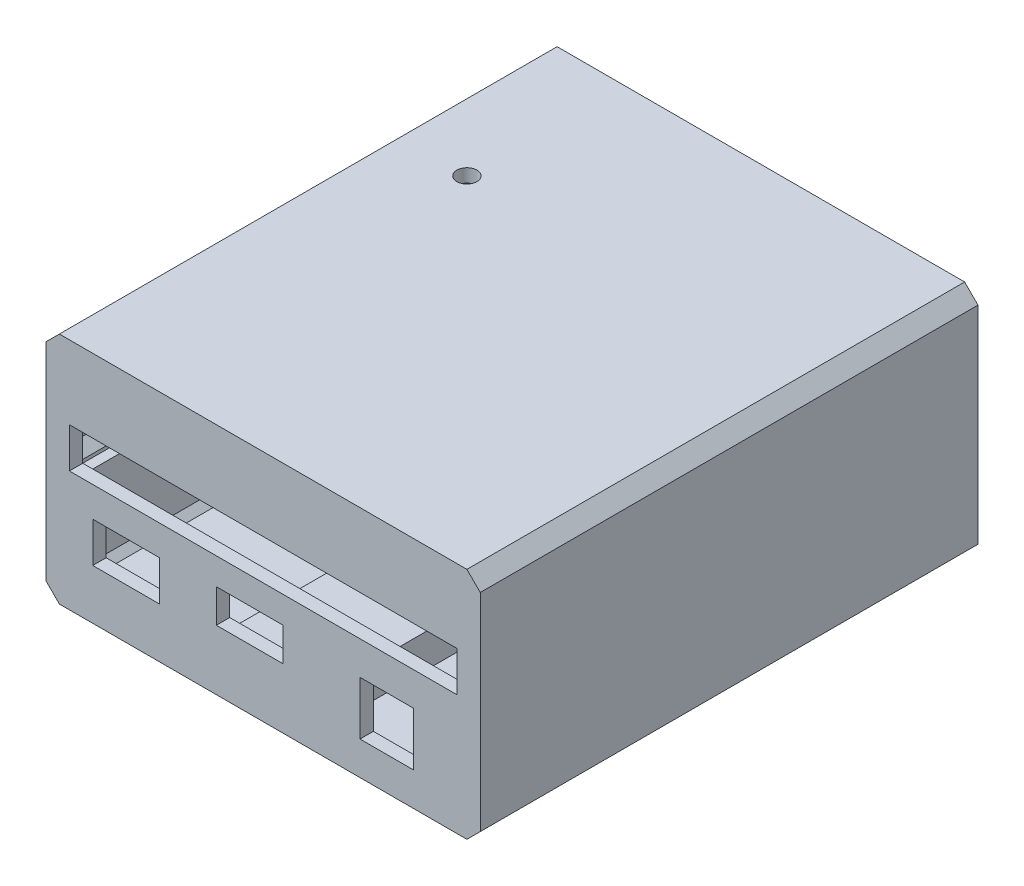
from build123d import *
from OCP.BRepFilletAPI import BRepFilletAPI_MakeChamfer

# Parameters (mm, degrees)
CROQUIS1_W              = 3.5
CROQUIS1_H              = 6
CROQUIS1_W_2            = 10
CROQUIS1_H_2            = 5
CROQUIS1_W_3            = 8
CROQUIS1_H_3            = 8
SALIENTE_EXTRUIR1_DEPTH = 2
CROQUIS2_W              = 65
CROQUIS2_H              = 35
CROQUIS2_W_2            = 61
CROQUIS2_H_2            = 31
SALIENTE_EXTRUIR2_DEPTH = 71
SALIENTE_EXTRUIR3_DEPTH = 70
CORTAR_EXTRUIR2_REACH   = 87.57
CROQUIS9_R              = 1.5
CHAFL_N3_SIZE           = 2
CHAFL_N2_SIZE           = 1
BOSS_EXTRUDE1_DEPTH     = 1.5
CHAMFER1_SIZE           = 0.1
CHAMFER1_SIZE_2         = 1.5
SKETCH2_W               = 1
SKETCH2_H               = 2
BOSS_EXTRUDE2_DEPTH     = 0.5
SKETCH3_W               = 15
SKETCH3_H               = 20
BOSS_EXTRUDE3_DEPTH     = 7
SKETCH4_W               = 13
SKETCH4_H               = 18
CUT_EXTRUDE1_DEPTH      = 5
SKETCH5_W               = 13
SKETCH5_H               = 2.5
BOSS_EXTRUDE4_DEPTH     = 12
CHAMFER2_SIZE2          = 5
CHAMFER2_SIZE           = 8.660254038
CHAMFER3_SIZE2          = 5
CHAMFER3_SIZE           = 8.660254038
CHAMFER4_SIZE           = 3
CHAMFER4_SIZE2          = 1.732050808
BOSS_EXTRUDE5_REACH     = 76.315
SKETCH6_W               = 15
SKETCH6_H               = 5
BOSS_EXTRUDE6_REACH     = 171.868
SKETCH7_W               = 9.865861754
SKETCH7_H               = 0.5


with BuildPart() as part:
    # Croquis1 → Saliente-Extruir1 (new body)
    # profile 1 of 4: a face of its own
    with BuildSketch(Plane.XY):
        Polygon((-32.5, 6.5), (-29, 6.5), (29, 6.5), (32.5, 6.5), (32.5, 17.5), (-32.5, 17.5), align=None)
    # profile 2 of 4: a face of its own
    with BuildSketch(Plane.XY):
        with Locations((-30.75, 3.5)):
            Rectangle(CROQUIS1_W, CROQUIS1_H)
    # profile 3 of 4: a face of its own
    with BuildSketch(Plane.XY):
        with Locations((30.75, 3.5)):
            Rectangle(CROQUIS1_W, CROQUIS1_H)
    # profile 4 of 4: a face of its own
    with BuildSketch(Plane.XY):
        Polygon((29, 0.5), (-29, 0.5), (-32.5, 0.5), (-32.5, -17.5), (32.5, -17.5), (32.5, 0.5), align=None)
        with Locations((-20.5, -7)):
            Rectangle(CROQUIS1_W_2, CROQUIS1_H, mode=Mode.SUBTRACT)
        with Locations((-2, -6)):
            Rectangle(CROQUIS1_W_2, CROQUIS1_H_2, mode=Mode.SUBTRACT)
        with Locations((18.5, -8.5)):
            Rectangle(CROQUIS1_W_3, CROQUIS1_H_3, mode=Mode.SUBTRACT)
    extrude(amount=SALIENTE_EXTRUIR1_DEPTH)

    # Croquis2 → Saliente-Extruir2 (add)
    with BuildSketch(Plane(origin=(0, 0, 0), x_dir=(-1, 0, 0), z_dir=(0, 0, -1))):
        Rectangle(CROQUIS2_W, CROQUIS2_H)
        Rectangle(CROQUIS2_W_2, CROQUIS2_H_2, mode=Mode.SUBTRACT)
    extrude(amount=SALIENTE_EXTRUIR2_DEPTH)

    # Croquis3 → Saliente-Extruir3 (add)
    with BuildSketch(Plane(origin=(0, 0, 0), x_dir=(-1, 0, 0), z_dir=(0, 0, -1))):
        Polygon((-30.5, 1), (-29, 1), (-30.5, 2.5), align=None)
        Polygon((-30.5, -1), (-30.5, -2.5), (-29, -1), align=None)
        Polygon((30.5, -1), (29, -1), (30.5, -2.5), align=None)
        Polygon((30.5, 1), (30.5, 2.5), (29, 1), align=None)
    extrude(amount=SALIENTE_EXTRUIR3_DEPTH)

    # Croquis9 → Cortar-Extruir2 (cut, up to next)
    with BuildSketch(Plane(origin=(0, 17.5, 0), x_dir=(1, 0, 0), z_dir=(0, 1, 0)), mode=Mode.PRIVATE) as cortar_extruir2_sk1:
        with Locations(Location((-20.5, 49, 0), (0, 0, 270))):
            Circle(CROQUIS9_R)
    cortar_extruir2_tool1 = extrude(cortar_extruir2_sk1.sketch, amount=-CORTAR_EXTRUIR2_REACH, mode=Mode.PRIVATE) & part.part
    add(cortar_extruir2_tool1.solids().sort_by_distance((-20.5, 17.5, -49))[0], mode=Mode.SUBTRACT)

    # Chaflán3
    chafl_n3_edges = [part.edges().sort_by_distance(p)[0] for p in [
        (-32.5, -17.5, -34.5),
        (-32.5, 17.5, -34.5),
        (32.5, 17.5, -34.5),
        (32.5, -17.5, -34.5),
    ]]
    chamfer(chafl_n3_edges, length=CHAFL_N3_SIZE)

    # Chaflán2
    chafl_n2_edges = [part.edges().sort_by_distance(p)[0] for p in [
        (-30.5, 15.5, -35.5),
        (30.5, 15.5, -35.5),
        (30.5, -15.5, -35.5),
        (-30.5, -15.5, -35.5),
    ]]
    chamfer(chafl_n2_edges, length=CHAFL_N2_SIZE)

    # Sketch1 → Boss-Extrude1 (add)
    with BuildSketch(Plane(origin=(0, 0, -71), x_dir=(-1, 0, 0), z_dir=(0, 0, -1))):
        Polygon((-32.5, 15.5), (-32.5, -15.5), (-30.5, -17.5), (30.5, -17.5), (32.5, -15.5), (32.5, 15.5), (30.5, 17.5), (-30.5, 17.5), align=None)
        Polygon((-31.55, 15.106497116), (-31.55, -15.106497116), (-30.106497116, -16.55), (30.106497116, -16.55), (31.55, -15.106497116), (31.55, 15.106497116), (30.106497116, 16.55), (-30.106497116, 16.55), align=None, mode=Mode.SUBTRACT)
    extrude(amount=BOSS_EXTRUDE1_DEPTH)

    # Chamfer1
    chamfer1_edges_1 = [part.edges().sort_by_distance(p)[0] for p in [
        (0, -16.55, -72.5),
    ]]
    chamfer1_side_1 = [part.faces().sort_by_distance(p)[0] for p in [
        (0, -16.552, -72.5),
    ]]
    chamfer1_edges_2 = [part.edges().sort_by_distance(p)[0] for p in [
        (-30.828248558, -15.828248558, -72.5),
    ]]
    chamfer1_side_2 = [part.faces().sort_by_distance(p)[0] for p in [
        (-30.829662771, -15.829662771, -72.5),
    ]]
    chamfer1_edges_3 = [part.edges().sort_by_distance(p)[0] for p in [
        (-31.55, 0, -72.5),
    ]]
    chamfer1_side_3 = [part.faces().sort_by_distance(p)[0] for p in [
        (-31.552, 0, -72.5),
    ]]
    chamfer1_edges_4 = [part.edges().sort_by_distance(p)[0] for p in [
        (-30.828248558, 15.828248558, -72.5),
    ]]
    chamfer1_side_4 = [part.faces().sort_by_distance(p)[0] for p in [
        (-30.829662771, 15.829662771, -72.5),
    ]]
    chamfer1_edges_5 = [part.edges().sort_by_distance(p)[0] for p in [
        (0, 16.55, -72.5),
    ]]
    chamfer1_side_5 = [part.faces().sort_by_distance(p)[0] for p in [
        (0, 16.552, -72.5),
    ]]
    chamfer1_edges_6 = [part.edges().sort_by_distance(p)[0] for p in [
        (30.828248558, 15.828248558, -72.5),
    ]]
    chamfer1_side_6 = [part.faces().sort_by_distance(p)[0] for p in [
        (30.829662771, 15.829662771, -72.5),
    ]]
    chamfer1_edges_7 = [part.edges().sort_by_distance(p)[0] for p in [
        (31.55, 0, -72.5),
    ]]
    chamfer1_side_7 = [part.faces().sort_by_distance(p)[0] for p in [
        (31.552, 0, -72.5),
    ]]
    chamfer1_edges_8 = [part.edges().sort_by_distance(p)[0] for p in [
        (30.828248558, -15.828248558, -72.5),
    ]]
    chamfer1_side_8 = [part.faces().sort_by_distance(p)[0] for p in [
        (30.829662771, -15.829662771, -72.5),
    ]]
    chamfer1 = BRepFilletAPI_MakeChamfer(part.part.solid().wrapped)
    for e in chamfer1_edges_1:
        chamfer1.Add(CHAMFER1_SIZE - 0.0001, CHAMFER1_SIZE_2 - 0.0001, e.wrapped, chamfer1_side_1[0].wrapped)
    for e in chamfer1_edges_2:
        chamfer1.Add(CHAMFER1_SIZE - 0.0001, CHAMFER1_SIZE_2 - 0.0001, e.wrapped, chamfer1_side_2[0].wrapped)
    for e in chamfer1_edges_3:
        chamfer1.Add(CHAMFER1_SIZE - 0.0001, CHAMFER1_SIZE_2 - 0.0001, e.wrapped, chamfer1_side_3[0].wrapped)
    for e in chamfer1_edges_4:
        chamfer1.Add(CHAMFER1_SIZE - 0.0001, CHAMFER1_SIZE_2 - 0.0001, e.wrapped, chamfer1_side_4[0].wrapped)
    for e in chamfer1_edges_5:
        chamfer1.Add(CHAMFER1_SIZE - 0.0001, CHAMFER1_SIZE_2 - 0.0001, e.wrapped, chamfer1_side_5[0].wrapped)
    for e in chamfer1_edges_6:
        chamfer1.Add(CHAMFER1_SIZE - 0.0001, CHAMFER1_SIZE_2 - 0.0001, e.wrapped, chamfer1_side_6[0].wrapped)
    for e in chamfer1_edges_7:
        chamfer1.Add(CHAMFER1_SIZE - 0.0001, CHAMFER1_SIZE_2 - 0.0001, e.wrapped, chamfer1_side_7[0].wrapped)
    for e in chamfer1_edges_8:
        chamfer1.Add(CHAMFER1_SIZE - 0.0001, CHAMFER1_SIZE_2 - 0.0001, e.wrapped, chamfer1_side_8[0].wrapped)
    add(Compound.cast(chamfer1.Shape()), mode=Mode.REPLACE)  # a hair under: the kernel refuses the full size

    # Sketch2 → Boss-Extrude2 (add)
    with BuildSketch(Plane(origin=(0, 0, -72.5), x_dir=(-1, 0, 0), z_dir=(0, 0, -1))):
        with Locations((-31.65, 0)):
            Rectangle(SKETCH2_W, SKETCH2_H)
        with Locations((31.65, 0)):
            Rectangle(SKETCH2_W, SKETCH2_H)
    extrude(amount=-BOSS_EXTRUDE2_DEPTH)

    # Sketch3 → Boss-Extrude3 (add)
    with BuildSketch(Plane.XZ.offset(17.5)):
        with Locations((0, -18)):
            Rectangle(SKETCH3_W, SKETCH3_H)
    extrude(amount=-BOSS_EXTRUDE3_DEPTH)

    # Sketch4 → Cut-Extrude1 (cut)
    with BuildSketch(Plane.XZ.offset(17.5)):
        with Locations((0, -18)):
            Rectangle(SKETCH4_W, SKETCH4_H)
    extrude(amount=-CUT_EXTRUDE1_DEPTH, mode=Mode.SUBTRACT)

    # Sketch5 → Boss-Extrude4 (add)
    with BuildSketch(Plane(origin=(0, 0, -9), x_dir=(-1, 0, 0), z_dir=(0, 0, -1))):
        with Locations((0, -16.25)):
            Rectangle(SKETCH5_W, SKETCH5_H)
    extrude(amount=BOSS_EXTRUDE4_DEPTH)

    # Chamfer2
    chamfer2_edges = [part.edges().sort_by_distance(p)[0] for p in [
        (0, -15.5, -28),
    ]]
    chamfer2_side = [part.faces().sort_by_distance(p)[0] for p in [
        (0, -15.5, -28.1),
    ]]
    chamfer(chamfer2_edges, length=CHAMFER2_SIZE - 0.0001, length2=CHAMFER2_SIZE2 - 0.0001, reference=chamfer2_side[0])  # a hair under: the kernel refuses the full size

    # Chamfer3
    chamfer3_edges = [part.edges().sort_by_distance(p)[0] for p in [
        (0, -17.5, -27),
    ]]
    chamfer3_side = [part.faces().sort_by_distance(p)[0] for p in [
        (0, -17.5, -27.1),
    ]]
    chamfer(chamfer3_edges, length=CHAMFER3_SIZE - 0.0001, length2=CHAMFER3_SIZE2 - 0.0001, reference=chamfer3_side[0])  # a hair under: the kernel refuses the full size

    # Chamfer4
    chamfer4_edges = [part.edges().sort_by_distance(p)[0] for p in [
        (0, -15, -21),
    ]]
    chamfer4_side = [part.faces().sort_by_distance(p)[0] for p in [
        (0, -15, -15),
    ]]
    chamfer(chamfer4_edges, length=CHAMFER4_SIZE, length2=CHAMFER4_SIZE2, reference=chamfer4_side[0])

    # Sketch6 → Boss-Extrude5 (add, up to next)
    with BuildSketch(Plane.XY.offset(-8), mode=Mode.PRIVATE) as boss_extrude5_sk1:
        with Locations((0, -13)):
            Rectangle(SKETCH6_W, SKETCH6_H)
    boss_extrude5_tool1 = extrude(boss_extrude5_sk1.sketch, amount=BOSS_EXTRUDE5_REACH, mode=Mode.PRIVATE) - part.part
    add(boss_extrude5_tool1.solids().sort_by_distance((0, -13, -8))[0])

    # Boss-Extrude6: up to this plane
    boss_extrude6_end = Plane(origin=(-6.5, -12.5, -17), z_dir=(0, 0, 1))
    # Sketch7 → Boss-Extrude6 (add, up to the surface)
    with BuildSketch(Plane(origin=(0, -3.455771366, 1.995190528), x_dir=(1, 0, 0), z_dir=(0, 0.8660254037844395, -0.4999999999999988)), mode=Mode.PRIVATE) as boss_extrude6_sk1:
        with Locations((1.567069123, 22.838457268)):
            Rectangle(SKETCH7_W, SKETCH7_H)
    boss_extrude6_tool1 = split(extrude(boss_extrude6_sk1.sketch, amount=BOSS_EXTRUDE6_REACH, dir=(0, 0, 1), mode=Mode.PRIVATE), bisect_by=boss_extrude6_end, keep=Keep.BOTH, mode=Mode.PRIVATE)
    add(boss_extrude6_tool1.solids().sort_by_distance((1.567069, -14.875, -17.783494))[0])


solid = part.part
